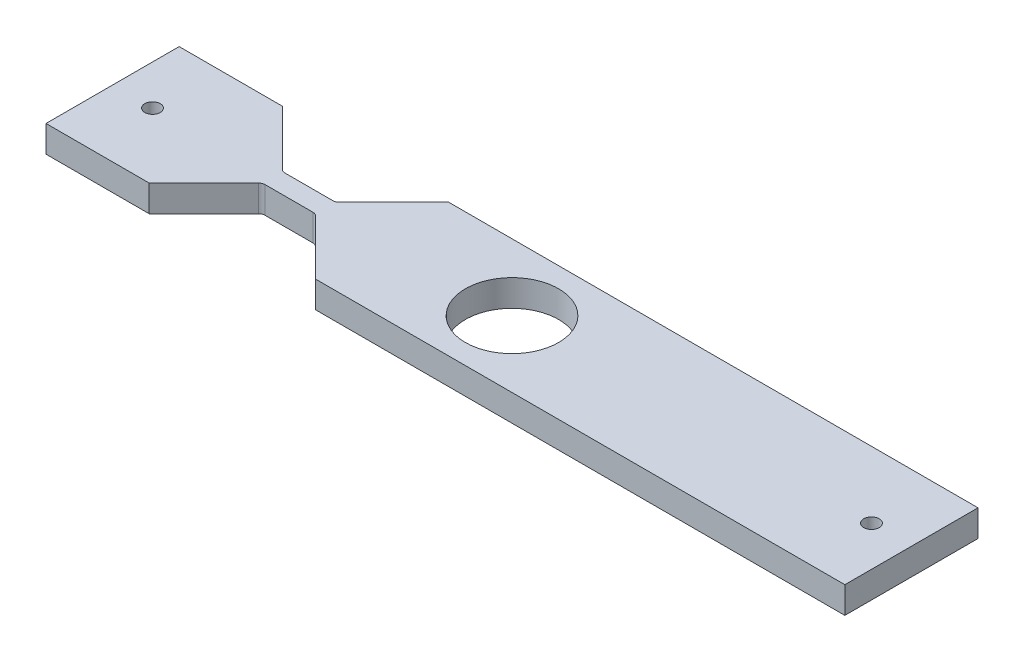
from build123d import *

# Parameters (mm, degrees)
SKETCH1_W           = 381
SKETCH1_H           = 63.5
BOSS_EXTRUDE1_DEPTH = 12.7
SKETCH2_R           = 22.225
CUT_EXTRUDE1_DEPTH  = 194.544833307
CUT_EXTRUDE2_DEPTH  = 194.544833307
FILLET1_R           = 3.175
SKETCH4_R           = 3.683
CUT_EXTRUDE3_DEPTH  = 194.544833307


with BuildPart() as part:
    # Sketch1 → Boss-Extrude1 (new body)
    with BuildSketch(Plane(origin=(0, 0, 0), x_dir=(1, 0, 0), z_dir=(0, 1, 0))):
        Rectangle(SKETCH1_W, SKETCH1_H)
    extrude(amount=BOSS_EXTRUDE1_DEPTH)

    # Sketch2 → Cut-Extrude1 (cut, through all)
    with BuildSketch(Plane(origin=(0, 12.7, 0), x_dir=(1, 0, 0), z_dir=(0, 1, 0))):
        Circle(SKETCH2_R)
    extrude(amount=-CUT_EXTRUDE1_DEPTH, mode=Mode.SUBTRACT)

    # Sketch3 → Cut-Extrude2 (cut, through all)
    with BuildSketch(Plane(origin=(0, 12.7, 0), x_dir=(1, 0, 0), z_dir=(0, 1, 0))):
        Polygon((-141.2875, 31.75), (-61.9125, 31.75), (-88.9, 4.7625), (-114.3, 4.7625), align=None)
        Polygon((-141.2875, -31.75), (-61.9125, -31.75), (-88.9, -4.7625), (-114.3, -4.7625), align=None)
    extrude(amount=-CUT_EXTRUDE2_DEPTH, mode=Mode.SUBTRACT)

    # Fillet1
    fillet1_edges = [part.edges().sort_by_distance(p)[0] for p in [
        (-114.3, 6.35, -4.7625),
        (-88.9, 6.35, -4.7625),
        (-88.9, 6.35, 4.7625),
        (-114.3, 6.35, 4.7625),
    ]]
    fillet(fillet1_edges, radius=FILLET1_R)

    # Sketch4 → Cut-Extrude3 (cut, through all)
    with BuildSketch(Plane(origin=(0, 12.7, 0), x_dir=(1, 0, 0), z_dir=(0, 1, 0))):
        with Locations((-171.45, 0)):
            Circle(SKETCH4_R)
        with Locations((171.45, 0)):
            Circle(SKETCH4_R)
    extrude(amount=-CUT_EXTRUDE3_DEPTH, mode=Mode.SUBTRACT)


solid = part.part
